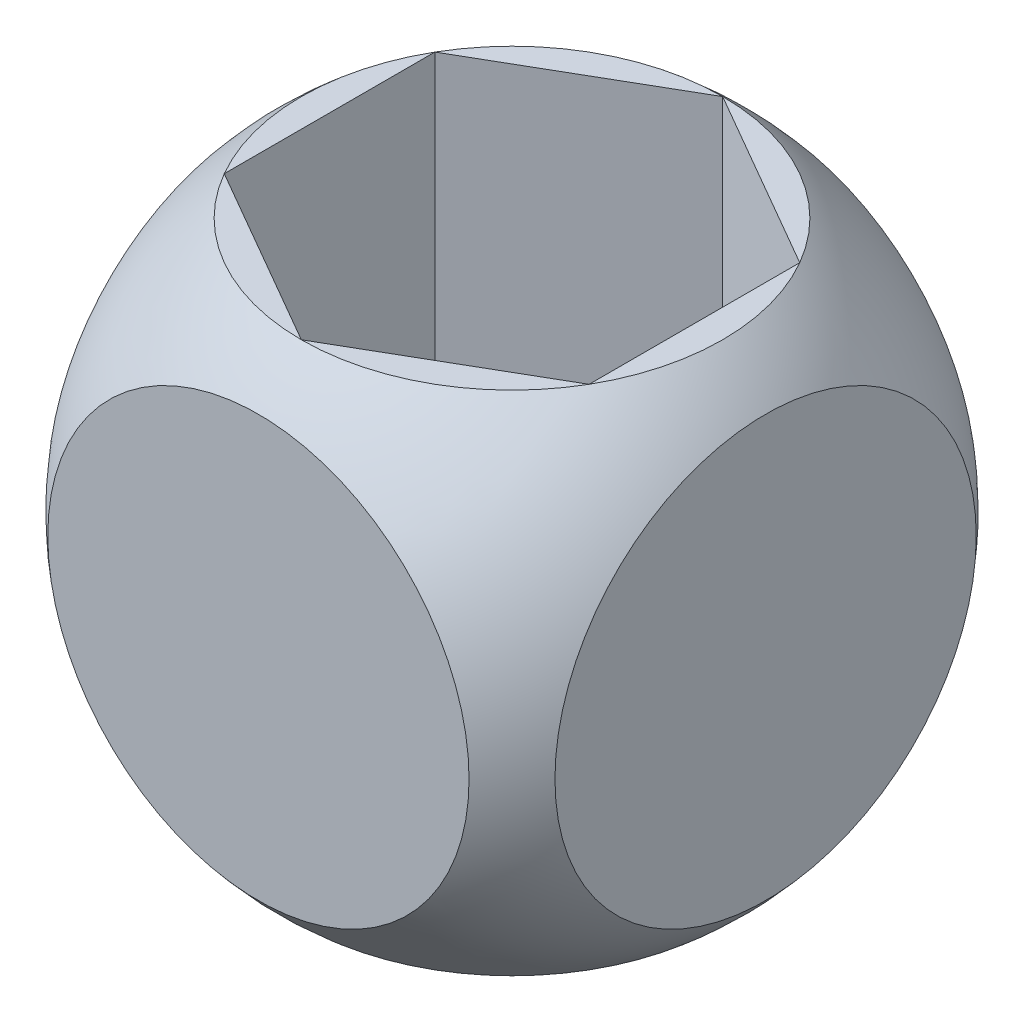
from build123d import *

# Parameters (mm, degrees)
P_IDAT_VYSUNUT_M1_DEPTH      = 50
P_IDAT_VYSUNUT_M1_DEPTH_BACK = 50
SKICA2_W                     = 100
SKICA2_H                     = 100
ODEBRAT_VYSUNUT_M1_DEPTH     = 123.474487139


with BuildPart() as part:
    # Skica1 → Rotovat1 (revolve)
    with BuildSketch(Plane.XY):
        with BuildLine():
            Line((0, 0), (-65, 0))
            ThreePointArc((-65, 0), (0, 65), (65, 0))
            Line((65, 0), (0, 0))
        make_face()
    revolve(axis=Axis((0, 0, 0), (1, 0, 0)))


with BuildPart() as body_2:
    # Skica2 → Přidat vysunutím1 (new, two sides: drawn at the far end of the back side and taken through both)
    with BuildSketch(Plane.XY.offset(-P_IDAT_VYSUNUT_M1_DEPTH_BACK)):
        Rectangle(SKICA2_W, SKICA2_H)
    extrude(amount=P_IDAT_VYSUNUT_M1_DEPTH + P_IDAT_VYSUNUT_M1_DEPTH_BACK)


with BuildPart() as part_1:
    add(part.part)

    # Průsečík1: read off the stored shape, not the designer's step
    # Průsečík1: intersect body 2
    add(body_2.part, mode=Mode.INTERSECT)

    # Skica3 → Odebrat vysunutím1 (cut, through all)
    with BuildSketch(Plane(origin=(0, 50, 0), x_dir=(1, 0, 0), z_dir=(0, 1, 0))):
        Polygon((0, 41.533119315), (-35.968736425, 20.766559657), (-35.968736425, -20.766559657), (0, -41.533119315), (35.968736425, -20.766559657), (35.968736425, 20.766559657), align=None)
    extrude(amount=-ODEBRAT_VYSUNUT_M1_DEPTH, mode=Mode.SUBTRACT)


solid = part_1.part
